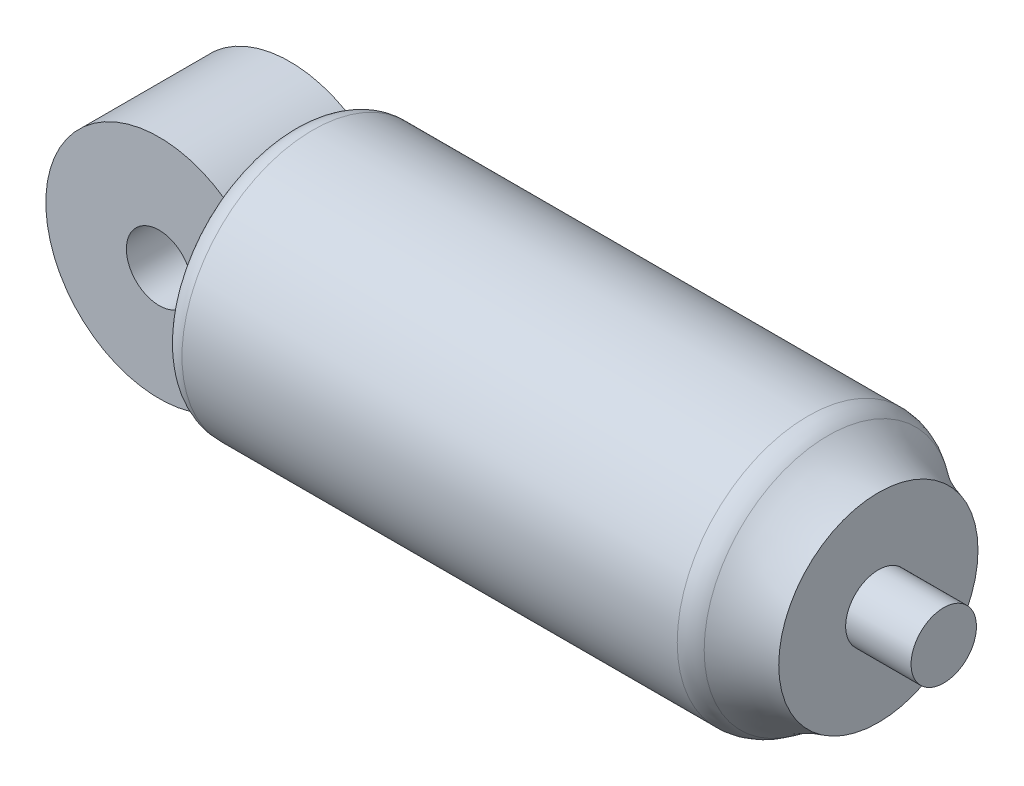
from build123d import *

# Parameters (mm, degrees)
SKETCH1_R                = 34.64
BOSS_EXTRUDE1_DEPTH      = 40
SKETCH2_R                = 10
CUT_EXTRUDE2_DEPTH       = 64.244440072
BOSS_EXTRUDE2_DEPTH      = 160
BOSS_EXTRUDE2_DEPTH_BACK = 20
SKETCH4_R                = 40
SKETCH5_W                = 40
SKETCH5_H                = 56.566053424
CUT_EXTRUDE3_DEPTH       = 20
FILLET1_R                = 10
FILLET2_R                = 7
SKETCH7_R                = 10
BOSS_EXTRUDE5_DEPTH      = 20


with BuildPart() as part:
    # Sketch1 → Boss-Extrude1 (new body)
    with BuildSketch(Plane.XY):
        Circle(SKETCH1_R)
    extrude(amount=BOSS_EXTRUDE1_DEPTH)

    # Sketch2 → Cut-Extrude2 (cut, through all)
    with BuildSketch(Plane.XY):
        Circle(SKETCH2_R)
    extrude(amount=CUT_EXTRUDE2_DEPTH, mode=Mode.SUBTRACT)

    # Sketch4 → Boss-Extrude2 (add, two sides: drawn at the far end of the back side and taken through both)
    with BuildSketch(Plane(origin=(40, 0, 0), x_dir=(0, 0, -1), z_dir=(1, 0, 0)).offset(-BOSS_EXTRUDE2_DEPTH_BACK)):
        with Locations((-20, 0)):
            Circle(SKETCH4_R)
    extrude(amount=BOSS_EXTRUDE2_DEPTH + BOSS_EXTRUDE2_DEPTH_BACK)

    # Sketch5 → Cut-Extrude3 (cut)
    with BuildSketch(Plane.ZY.offset(-20)):
        with Locations((20, 0)):
            Rectangle(SKETCH5_W, SKETCH5_H)
    extrude(amount=-CUT_EXTRUDE3_DEPTH, mode=Mode.SUBTRACT)


with BuildPart() as cut_extrude3_piece_1:
    # of the separate pieces the step leaves, piece 1, a body of its own (cut_extrude3_pieces)
    add(part.part.solids().sort_by_distance((20, 0, -20))[0])

    # Sketch6 → Cut-Revolve1 (revolve, cut)
    with BuildSketch(Plane(origin=(0, 0, 0), x_dir=(1, 0, 0), z_dir=(0, 1, 0))):
        with BuildLine():
            Line((182.124448295, 20), (200, 20))
            Line((200, 20), (200, 10.474881664))
            ThreePointArc((200, 10.474881664), (190.460193711, 14.107625347), (182.124448295, 20))
        make_face()
    revolve(axis=Axis((200, 0, 20), (-1, 0, 0)), mode=Mode.SUBTRACT)

    # Fillet1
    fillet1_edges = [cut_extrude3_piece_1.edges().sort_by_distance(p)[0] for p in [
        (182.124448295, 0, 60),
    ]]
    fillet(fillet1_edges, radius=FILLET1_R)

    # Fillet2
    # the kernel refuses this fillet: 7 mm, written as the material it takes off along each edge
    with BuildSketch(Plane(origin=(20, 0, 20), x_dir=(0, 0, -1), z_dir=(0, -1, 0))) as fillet2_piece_1:
        with BuildLine():
            CenterArc((40 - FILLET2_R, FILLET2_R), FILLET2_R, 270, 90)
            Line((40 - FILLET2_R, 0), (40, 0))
            Line((40, 0), (40, FILLET2_R))
        make_face()
    revolve(axis=Axis((20, 0, 20), (1, 0, 0)), mode=Mode.SUBTRACT)

    # Sketch7 → Boss-Extrude5 (add)
    with BuildSketch(Plane(origin=(200, 0, 0), x_dir=(0, 0, -1), z_dir=(1, 0, 0))):
        with Locations((-20, 0)):
            Circle(SKETCH7_R)
    extrude(amount=BOSS_EXTRUDE5_DEPTH)


with BuildPart() as cut_extrude3_piece_2:
    # of the separate pieces the step leaves, piece 2, a body of its own (cut_extrude3_pieces)
    add(part.part.solids().sort_by_distance((10, 0, 0))[0])


solid = Compound([cut_extrude3_piece_1.part, cut_extrude3_piece_2.part])
